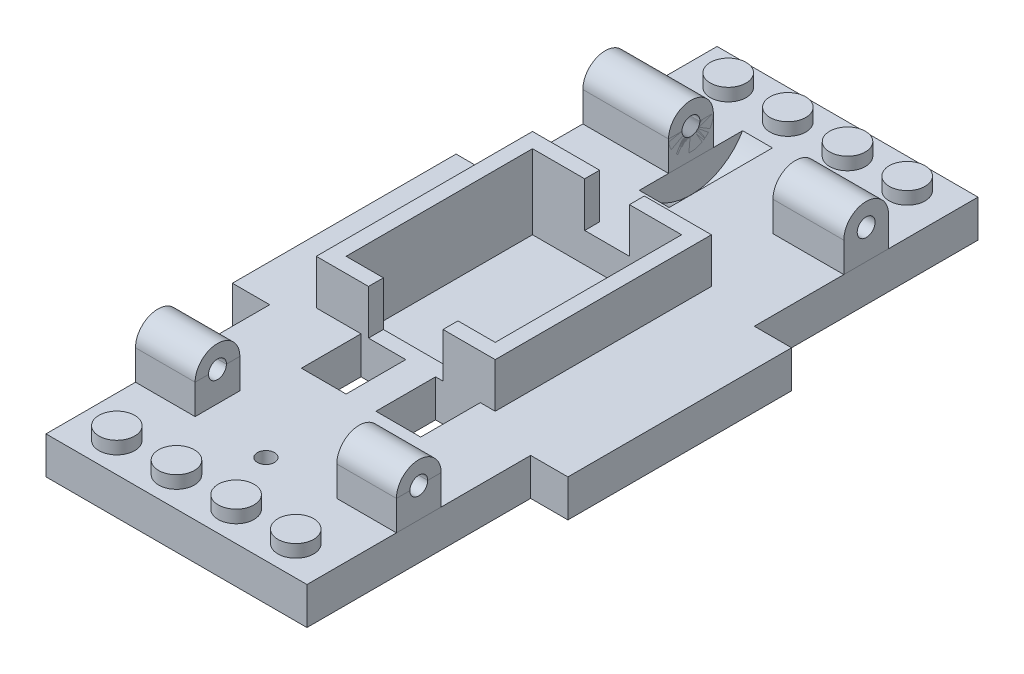
from build123d import *

# Parameters (mm, degrees)
SKETCH1_W             = 9.5
SKETCH1_H             = 1.8
SKETCH1_H_2           = 1.2
SKETCH1_H_3           = 3
SKETCH1_W_2           = 11.5
SKETCH1_W_3           = 8
SKETCH1_H_4           = 6
BOSS_EXTRUDE1_DEPTH   = 4
SKETCH1_3_W           = 8
SKETCH1_3_H           = 1.8
REVOLVE1_ANGLE        = 180
REVOLVE2_START        = -17.5
REVOLVE2_OUTLINE_R    = 3
REVOLVE2_OUTLINE_R_2  = 1.2
REVOLVE2_DEPTH        = 11.5
REVOLVE2_START_2      = 8
REVOLVE2_2_DEPTH      = 9.5
SKETCH1_6_W           = 11.5
SKETCH1_6_H           = 1.2
SKETCH1_6_W_2         = 9.5
BOSS_EXTRUDE2_START   = -4
SKETCH1_7_W           = 35
SKETCH1_7_H           = 90
SKETCH1_7_W_2         = 5
SKETCH1_7_H_2         = 30
BOSS_EXTRUDE2_DEPTH   = 5
SKETCH1_9_W           = 8
SKETCH1_9_H           = 1.2
SKETCH1_10_W          = 4
SKETCH1_10_H          = 3
SKETCH1_10_W_2        = 10
SKETCH1_10_H_2        = 1
CUT_EXTRUDE2_DEPTH    = 4
SKETCH9_R             = 1.15
CUT_EXTRUDE4_DEPTH    = 5
SKETCH10_W            = 6
SKETCH10_H            = 8
CUT_EXTRUDE5_DEPTH    = 5
BOSS_EXTRUDE3_DEPTH   = 6
BOSS_EXTRUDE4_START   = -2.3
SKETCH1_12_R          = 2.4
BOSS_EXTRUDE4_DEPTH   = 1.7
BOSS_EXTRUDE4_2_DEPTH = 1.7
BOSS_EXTRUDE4_3_DEPTH = 1.7
BOSS_EXTRUDE4_4_DEPTH = 1.7
BOSS_EXTRUDE4_5_DEPTH = 1.7
BOSS_EXTRUDE4_6_DEPTH = 1.7
BOSS_EXTRUDE4_7_DEPTH = 1.7
BOSS_EXTRUDE4_8_DEPTH = 1.7


# Read off the part's stored shape, not the designer's step: Revolve2
with BuildPart() as part:
    # Sketch1 → Boss-Extrude1 (new body)
    with BuildSketch(Plane(origin=(0, 0, 0), x_dir=(1, 0, 0), z_dir=(0, 1, 0))):
        with Locations((12.75, 27.9)):
            Rectangle(SKETCH1_W, SKETCH1_H)
        with Locations((12.75, 29.4)):
            Rectangle(SKETCH1_W, SKETCH1_H_2)
        with Locations((12.75, 31.5)):
            Rectangle(SKETCH1_W, SKETCH1_H_3)
        with Locations((-11.75, 27.9)):
            Rectangle(SKETCH1_W_2, SKETCH1_H)
        with Locations((-11.75, 29.4)):
            Rectangle(SKETCH1_W_2, SKETCH1_H_2)
        with Locations((-11.75, 31.5)):
            Rectangle(SKETCH1_W_2, SKETCH1_H_3)
        with Locations((13.5, -30)):
            Rectangle(SKETCH1_W_3, SKETCH1_H_4)
        with Locations((-13.5, -30)):
            Rectangle(SKETCH1_W_3, SKETCH1_H_4)
    extrude(amount=-BOSS_EXTRUDE1_DEPTH)

    # Revolve2 2 outline → Revolve2 2 (add)
    with BuildSketch(Plane.YZ.offset(REVOLVE2_START_2)):
        with BuildLine():
            Line((0, -27), (0, -28.8))
            ThreePointArc((0, -28.8), (1.2, -30), (0, -31.2))
            Line((0, -31.2), (0, -33))
            ThreePointArc((0, -33), (3, -30), (0, -27))
        make_face()
    extrude(amount=REVOLVE2_2_DEPTH)

    # Sketch1<6> → Cut-Revolve2 (revolve, cut)
    with BuildSketch(Plane(origin=(0, 0, 0), x_dir=(1, 0, 0), z_dir=(0, 1, 0))):
        with Locations((-11.75, 29.4)):
            Rectangle(SKETCH1_6_W, SKETCH1_6_H)
        with Locations((12.75, 29.4)):
            Rectangle(SKETCH1_6_W_2, SKETCH1_6_H)
        Polygon((-2, 30), (-6, 30), (-6, 28.8), (8, 28.8), (8, 30), align=None)
    revolve(axis=Axis((-17.5, 0, -30), (1, 0, 0)), mode=Mode.SUBTRACT)

    # Sketch1<9> → Cut-Revolve7 (revolve, cut)
    with BuildSketch(Plane(origin=(0, 0, 0), x_dir=(1, 0, 0), z_dir=(0, 1, 0))):
        with Locations((-13.5, -30.6)):
            Rectangle(SKETCH1_9_W, SKETCH1_9_H)
        with Locations((13.5, -30.6)):
            Rectangle(SKETCH1_9_W, SKETCH1_9_H)
    revolve(axis=Axis((-17.5, 0, 30), (1, 0, 0)), mode=Mode.SUBTRACT)


with BuildPart() as body_2:
    # Sketch1<3> → Revolve1 (revolve)
    with BuildSketch(Plane(origin=(0, 0, 0), x_dir=(1, 0, 0), z_dir=(0, 1, 0))):
        with Locations((-13.5, -32.1)):
            Rectangle(SKETCH1_3_W, SKETCH1_3_H)
        with Locations((13.5, -32.1)):
            Rectangle(SKETCH1_3_W, SKETCH1_3_H)
    revolve(axis=Axis((-17.5, 0, 30), (-1, 0, 0)), revolution_arc=REVOLVE1_ANGLE)


with BuildPart() as body_3:
    # Revolve2 outline → Revolve2 (new body)
    with BuildSketch(Plane.YZ.offset(REVOLVE2_START)):
        with Locations((0, -30)):
            Circle(REVOLVE2_OUTLINE_R)
        with Locations((0, -30)):
            Circle(REVOLVE2_OUTLINE_R_2, mode=Mode.SUBTRACT)
    extrude(amount=REVOLVE2_DEPTH)


with BuildPart() as body_4:
    # Sketch1<7> → Boss-Extrude2 (new body)
    with BuildSketch(Plane(origin=(0, 0, 0), x_dir=(1, 0, 0), z_dir=(0, 1, 0)).offset(BOSS_EXTRUDE2_START)):
        Rectangle(SKETCH1_7_W, SKETCH1_7_H)
        with Locations((-20, 0)):
            Rectangle(SKETCH1_7_W_2, SKETCH1_7_H_2)
        with Locations((20, 0)):
            Rectangle(SKETCH1_7_W_2, SKETCH1_7_H_2)
    extrude(amount=-BOSS_EXTRUDE2_DEPTH)

    # Sketch1<10> → Cut-Revolve8 (revolve, cut)
    with BuildSketch(Plane(origin=(0, 0, 0), x_dir=(1, 0, 0), z_dir=(0, 1, 0)), mode=Mode.PRIVATE) as cut_revolve8_sk:
        Polygon((-6, 38), (-6, 33), (-2, 33), (-2, 34), (-2, 38), align=None)
        with Locations((-4, 31.5)):
            Rectangle(SKETCH1_10_W, SKETCH1_10_H)
        with Locations((3, 33.5)):
            Rectangle(SKETCH1_10_W_2, SKETCH1_10_H_2)
        with Locations((3, 31.5)):
            Rectangle(SKETCH1_10_W_2, SKETCH1_10_H)
    revolve(cut_revolve8_sk.sketch.rotate(Axis((-17.5, 0, -30), (1, 0, 0)), 180), axis=Axis((-17.5, 0, -30), (1, 0, 0)), mode=Mode.SUBTRACT)

    # Sketch4 → Cut-Extrude2 (cut)
    with BuildSketch(Plane(origin=(0, -4, 0), x_dir=(1, 0, 0), z_dir=(0, 1, 0))):
        Polygon((-12, 14.75), (-5, 14.75), (8, 14.75), (8, -10.25), (-12, -10.25), align=None)
    extrude(amount=-CUT_EXTRUDE2_DEPTH, mode=Mode.SUBTRACT)

    # Sketch9 → Cut-Extrude4 (cut)
    with BuildSketch(Plane.XZ.offset(9)):
        with Locations(Location((0, 33, 0), (0, 0, 270))):
            Circle(SKETCH9_R)
        with Locations(Location((0, -20, 0), (0, 0, 270))):
            Circle(SKETCH9_R)
    extrude(amount=-CUT_EXTRUDE4_DEPTH, mode=Mode.SUBTRACT)

    # Sketch10 → Cut-Extrude5 (cut)
    with BuildSketch(Plane(origin=(0, -4, 0), x_dir=(1, 0, 0), z_dir=(0, 1, 0))):
        with Locations((-5, -16.25)):
            Rectangle(SKETCH10_W, SKETCH10_H)
        with Locations((5, -16.25)):
            Rectangle(SKETCH10_W, SKETCH10_H)
    extrude(amount=-CUT_EXTRUDE5_DEPTH, mode=Mode.SUBTRACT)

    # Sketch4<6> → Boss-Extrude3 (add)
    with BuildSketch(Plane(origin=(0, -4, 0), x_dir=(1, 0, 0), z_dir=(0, 1, 0))):
        Polygon((-12, -10.25), (-12, 14.75), (-5, 14.75), (-5, 16.75), (-14, 16.75), (-14, -12.25), (-7, -12.25), (-7, -10.25), align=None)
        Polygon((1, 16.75), (1, 14.75), (8, 14.75), (8, -10.25), (3, -10.25), (3, -12.25), (10, -12.25), (10, 16.75), align=None)
    extrude(amount=BOSS_EXTRUDE3_DEPTH)


with BuildPart() as body_5:
    # Sketch1<12> → Boss-Extrude4 (new body)
    with BuildSketch(Plane(origin=(0, 0, 0), x_dir=(1, 0, 0), z_dir=(0, 1, 0)).offset(BOSS_EXTRUDE4_START)):
        with Locations(Location((-4, 41, 0), (0, 0, 270))):
            Circle(SKETCH1_12_R)
    extrude(amount=-BOSS_EXTRUDE4_DEPTH)


with BuildPart() as body_6:
    # Sketch1<12> → Boss-Extrude4 2 (new body)
    with BuildSketch(Plane(origin=(0, 0, 0), x_dir=(1, 0, 0), z_dir=(0, 1, 0)).offset(BOSS_EXTRUDE4_START)):
        with Locations(Location((4, 41, 0), (0, 0, 270))):
            Circle(SKETCH1_12_R)
    extrude(amount=-BOSS_EXTRUDE4_2_DEPTH)


with BuildPart() as body_7:
    # Sketch1<12> → Boss-Extrude4 3 (new body)
    with BuildSketch(Plane(origin=(0, 0, 0), x_dir=(1, 0, 0), z_dir=(0, 1, 0)).offset(BOSS_EXTRUDE4_START)):
        with Locations(Location((-12, 41, 0), (0, 0, 270))):
            Circle(SKETCH1_12_R)
    extrude(amount=-BOSS_EXTRUDE4_3_DEPTH)


with BuildPart() as body_8:
    # Sketch1<12> → Boss-Extrude4 4 (new body)
    with BuildSketch(Plane(origin=(0, 0, 0), x_dir=(1, 0, 0), z_dir=(0, 1, 0)).offset(BOSS_EXTRUDE4_START)):
        with Locations(Location((12, 41, 0), (0, 0, 270))):
            Circle(SKETCH1_12_R)
    extrude(amount=-BOSS_EXTRUDE4_4_DEPTH)


with BuildPart() as body_9:
    # Sketch1<12> → Boss-Extrude4 5 (new body)
    with BuildSketch(Plane(origin=(0, 0, 0), x_dir=(1, 0, 0), z_dir=(0, 1, 0)).offset(BOSS_EXTRUDE4_START)):
        with Locations(Location((12, -41, 0), (0, 0, 270))):
            Circle(SKETCH1_12_R)
    extrude(amount=-BOSS_EXTRUDE4_5_DEPTH)


with BuildPart() as body_10:
    # Sketch1<12> → Boss-Extrude4 6 (new body)
    with BuildSketch(Plane(origin=(0, 0, 0), x_dir=(1, 0, 0), z_dir=(0, 1, 0)).offset(BOSS_EXTRUDE4_START)):
        with Locations(Location((4, -41, 0), (0, 0, 270))):
            Circle(SKETCH1_12_R)
    extrude(amount=-BOSS_EXTRUDE4_6_DEPTH)


with BuildPart() as body_11:
    # Sketch1<12> → Boss-Extrude4 7 (new body)
    with BuildSketch(Plane(origin=(0, 0, 0), x_dir=(1, 0, 0), z_dir=(0, 1, 0)).offset(BOSS_EXTRUDE4_START)):
        with Locations(Location((-4, -41, 0), (0, 0, 270))):
            Circle(SKETCH1_12_R)
    extrude(amount=-BOSS_EXTRUDE4_7_DEPTH)


with BuildPart() as body_12:
    # Sketch1<12> → Boss-Extrude4 8 (new body)
    with BuildSketch(Plane(origin=(0, 0, 0), x_dir=(1, 0, 0), z_dir=(0, 1, 0)).offset(BOSS_EXTRUDE4_START)):
        with Locations(Location((-12, -41, 0), (0, 0, 270))):
            Circle(SKETCH1_12_R)
    extrude(amount=-BOSS_EXTRUDE4_8_DEPTH)


solid = Compound([part.part, body_2.part, body_3.part, body_4.part, body_5.part, body_6.part, body_7.part, body_8.part, body_9.part, body_10.part, body_11.part, body_12.part])
